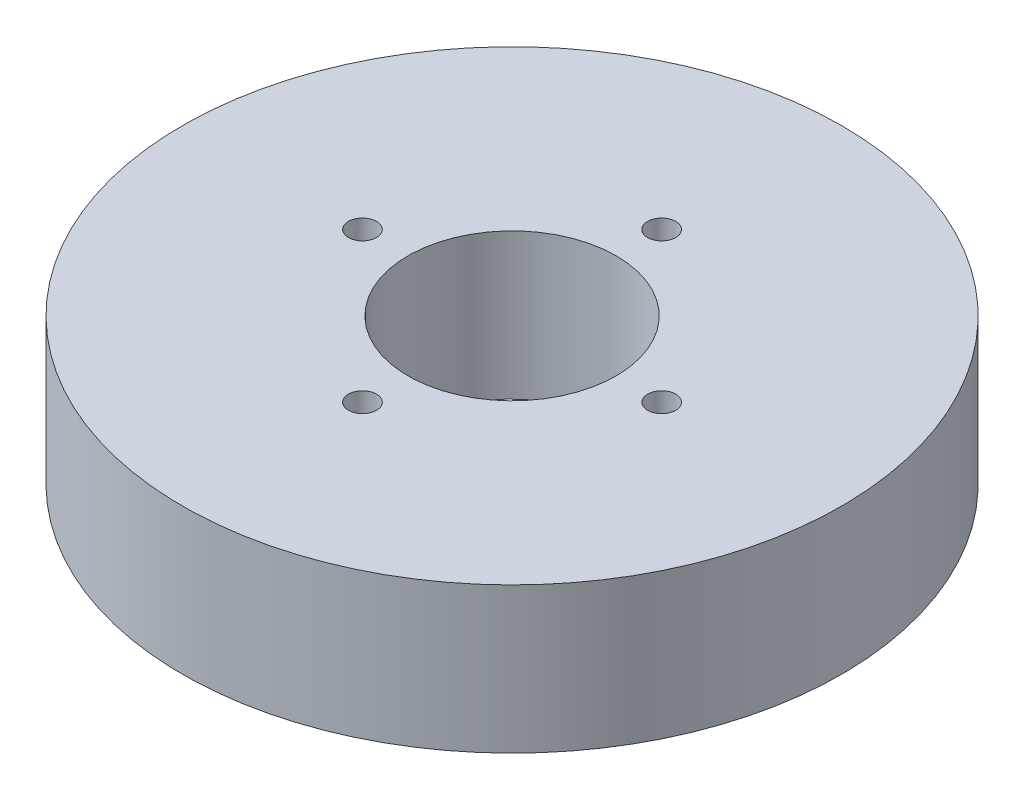
from build123d import *

# Parameters (mm, degrees)
SKETCH1_R           = 47.5
BOSS_EXTRUDE1_DEPTH = 21
SKETCH2_R           = 15
CUT_EXTRUDE1_DEPTH  = 71.381105419
SKETCH3_R           = 2.022636031
CUT_EXTRUDE2_DEPTH  = 19.214526851
CIRPATTERN1_COUNT   = 4


with BuildPart() as part:
    # Sketch1 → Boss-Extrude1 (new body)
    with BuildSketch(Plane(origin=(0, 0, 0), x_dir=(1, 0, 0), z_dir=(0, 1, 0))):
        Circle(SKETCH1_R)
    extrude(amount=BOSS_EXTRUDE1_DEPTH)

    # Sketch2 → Cut-Extrude1 (cut, through all)
    with BuildSketch(Plane(origin=(0, 0, 0), x_dir=(1, 0, 0), z_dir=(0, 1, 0))):
        Circle(SKETCH2_R)
    extrude(amount=CUT_EXTRUDE1_DEPTH, mode=Mode.SUBTRACT)

    # Sketch3 → Cut-Extrude2 (cut)
    with BuildSketch(Plane(origin=(0, 21, 0), x_dir=(1, 0, 0), z_dir=(0, 1, 0))):
        with Locations((-21.561126604, 0)):
            Circle(SKETCH3_R)
    cut_extrude2 = extrude(amount=-CUT_EXTRUDE2_DEPTH, mode=Mode.SUBTRACT)

    # CirPattern1: Cut-Extrude2 ×4 about axis
    cirpattern1_axis = Axis((0, 0, 0), (0, 1, 0))
    for i in range(1, CIRPATTERN1_COUNT):
        add(cut_extrude2.rotate(cirpattern1_axis, i * 360 / CIRPATTERN1_COUNT), mode=Mode.SUBTRACT)


solid = part.part
